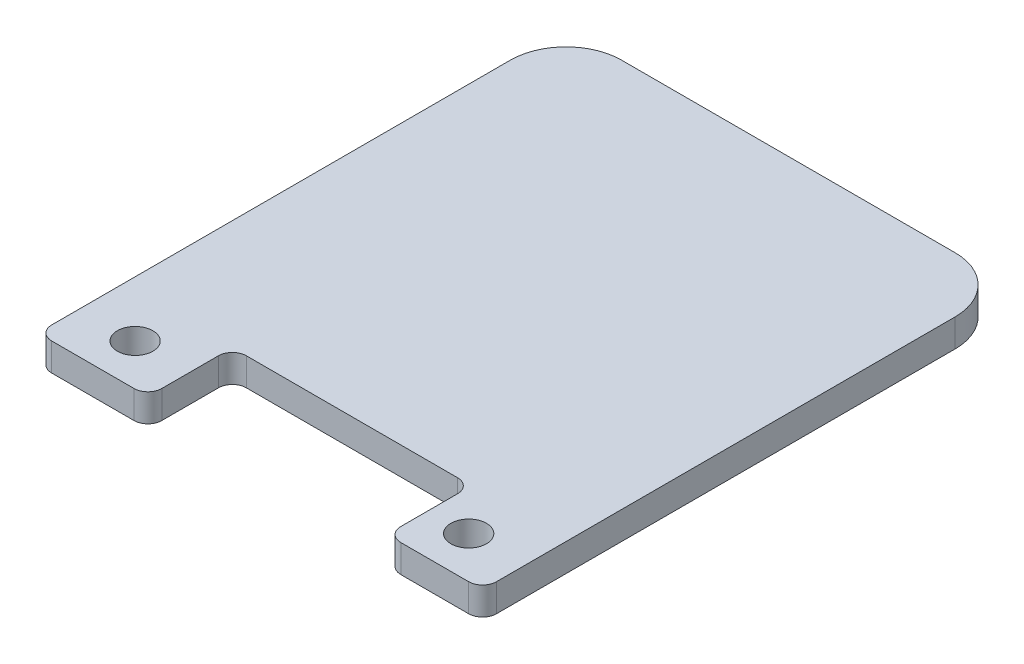
from build123d import *

# Parameters (mm, degrees)
SKETCH1_W           = 50.8
SKETCH1_H           = 60.325
BOSS_EXTRUDE1_DEPTH = 3.175
SKETCH2_R           = 2.032
CUT_EXTRUDE1_DEPTH  = 40.560296147
SKETCH3_W           = 27.305
SKETCH3_H           = 9.652
CUT_EXTRUDE2_DEPTH  = 40.560296147
FILLET1_R           = 1.5875
FILLET2_R           = 6.35


with BuildPart() as part:
    # Sketch1 → Boss-Extrude1 (new body)
    with BuildSketch(Plane(origin=(0, 0, 0), x_dir=(1, 0, 0), z_dir=(0, 1, 0))):
        Rectangle(SKETCH1_W, SKETCH1_H)
    extrude(amount=BOSS_EXTRUDE1_DEPTH)

    # Sketch2 → Cut-Extrude1 (cut, through all)
    with BuildSketch(Plane(origin=(0, 0, 0), x_dir=(-1, 0, 0), z_dir=(0, -1, 0))):
        with Locations((-19.05, -25.4)):
            Circle(SKETCH2_R)
        with Locations((19.05, -25.4)):
            Circle(SKETCH2_R)
    extrude(amount=-CUT_EXTRUDE1_DEPTH, mode=Mode.SUBTRACT)

    # Sketch3 → Cut-Extrude2 (cut, through all)
    with BuildSketch(Plane(origin=(0, 3.175, 0), x_dir=(1, 0, 0), z_dir=(0, 1, 0))):
        with Locations((0.8255, -25.3365)):
            Rectangle(SKETCH3_W, SKETCH3_H)
    extrude(amount=-CUT_EXTRUDE2_DEPTH, mode=Mode.SUBTRACT)

    # Fillet1
    fillet1_edges = [part.edges().sort_by_distance(p)[0] for p in [
        (-25.4, 1.5875, 30.1625),
        (-12.827, 1.5875, 30.1625),
        (-12.827, 1.5875, 20.5105),
        (14.478, 1.5875, 20.5105),
        (14.478, 1.5875, 30.1625),
        (25.4, 1.5875, 30.1625),
    ]]
    fillet(fillet1_edges, radius=FILLET1_R)

    # Fillet2
    fillet2_edges = [part.edges().sort_by_distance(p)[0] for p in [
        (-25.4, 1.5875, -30.1625),
        (25.4, 1.5875, -30.1625),
    ]]
    fillet(fillet2_edges, radius=FILLET2_R)


solid = part.part
